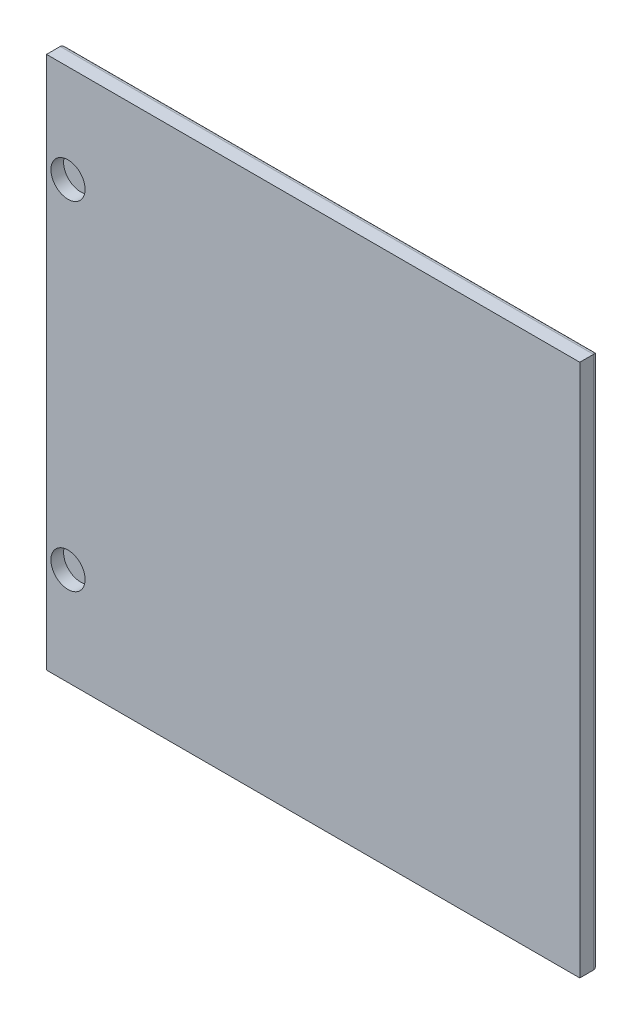
from build123d import *

# Parameters (mm, degrees)
SKETCH_1_W             = 546
SKETCH_1_H             = 546
EXTRUDE_1889_DEPTH     = 19
SKETCH_3_R             = 17.5
CUT_EXTRUDE_1_DEPTH    = 13
SKETCH_4_R             = 17.5
CUT_EXTRUDE_2_DEPTH    = 13
CUT_EXTRUDE_3609_DEPTH = 6
FILLET_1_R             = 5


with BuildPart() as part:
    # Эскиз1 → Extrude 1889 (new body)
    with BuildSketch(Plane.XY):
        with Locations((273, 273)):
            Rectangle(SKETCH_1_W, SKETCH_1_H)
    extrude(amount=EXTRUDE_1889_DEPTH)

    # Эскиз3 → Отверстие 1 (cut)
    with BuildSketch(Plane.XY.offset(19)):
        with Locations((22, 100)):
            Circle(SKETCH_3_R)
    extrude(amount=-CUT_EXTRUDE_1_DEPTH, mode=Mode.SUBTRACT)

    # Эскиз4 → Отверстие 2 (cut)
    with BuildSketch(Plane.XY.offset(19)):
        with Locations((22, 446)):
            Circle(SKETCH_4_R)
    extrude(amount=-CUT_EXTRUDE_2_DEPTH, mode=Mode.SUBTRACT)

    # Эскиз11 → Cut-Extrude 3609 (cut)
    # profile 1 of 2: a face of its own
    with BuildSketch(Plane(origin=(0, 0, 0), x_dir=(-1, 0, 0), z_dir=(0, 0, -1))):
        with BuildLine():
            Line((-509, 469.600882186), (-509, 76.399117814))
            ThreePointArc((-509, 76.399117814), (-475.192388155, 70.807611845), (-469.600882186, 37))
            Line((-469.600882186, 37), (-76.399117814, 37))
            ThreePointArc((-76.399117814, 37), (-70.807611845, 70.807611845), (-37, 76.399117814))
            Line((-37, 76.399117814), (-37, 469.600882186))
            ThreePointArc((-37, 469.600882186), (-70.807611845, 475.192388155), (-76.399117814, 509))
            Line((-76.399117814, 509), (-469.600882186, 509))
            ThreePointArc((-469.600882186, 509), (-475.192388155, 475.192388155), (-509, 469.600882186))
        make_face()
        with BuildLine():
            ThreePointArc((-506, 465.154062462), (-473.071067812, 473.071067812), (-465.154062462, 506))
            Line((-465.154062462, 506), (-80.845937538, 506))
            ThreePointArc((-80.845937538, 506), (-72.928932188, 473.071067812), (-40, 465.154062462))
            Line((-40, 465.154062462), (-40, 80.845937538))
            ThreePointArc((-40, 80.845937538), (-72.928932188, 72.928932188), (-80.845937538, 40))
            Line((-80.845937538, 40), (-465.154062462, 40))
            ThreePointArc((-465.154062462, 40), (-473.071067812, 72.928932188), (-506, 80.845937538))
            Line((-506, 80.845937538), (-506, 465.154062462))
        make_face(mode=Mode.SUBTRACT)
    # profile 2 of 2: a face of its own
    with BuildSketch(Plane(origin=(0, 0, 0), x_dir=(-1, 0, 0), z_dir=(0, 0, -1))):
        with BuildLine():
            ThreePointArc((-496, 92.426406871), (-466, 80), (-453.573593129, 50))
            Line((-453.573593129, 50), (-92.426406871, 50))
            ThreePointArc((-92.426406871, 50), (-80, 80), (-50, 92.426406871))
            Line((-50, 92.426406871), (-50, 453.573593129))
            ThreePointArc((-50, 453.573593129), (-80, 466), (-92.426406871, 496))
            Line((-92.426406871, 496), (-453.573593129, 496))
            ThreePointArc((-453.573593129, 496), (-466, 466), (-496, 453.573593129))
            Line((-496, 453.573593129), (-496, 92.426406871))
        make_face()
    extrude(amount=-CUT_EXTRUDE_3609_DEPTH, mode=Mode.SUBTRACT)

    # Скругление1
    fillet_1_edges = [part.edges().sort_by_distance(p)[0] for p in [
        (273, 0, 0),
        (546, 273, 0),
        (273, 546, 0),
        (0, 273, 0),
    ]]
    fillet(fillet_1_edges, radius=FILLET_1_R)


solid = part.part
